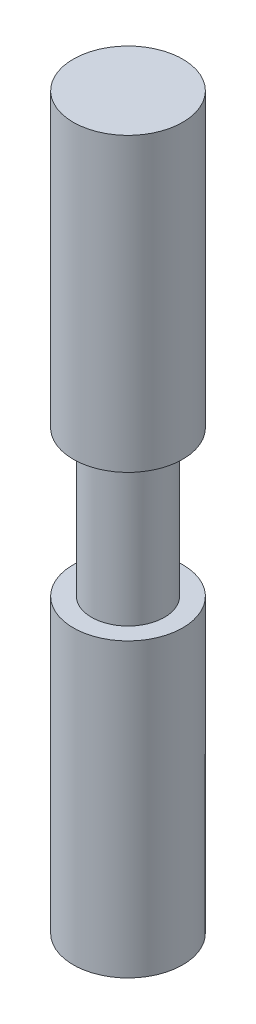
from build123d import *

# Parameters (mm, degrees)
SKETCH1_R           = 6.35
BOSS_EXTRUDE1_DEPTH = 25.4
SKETCH2_R           = 9.525
BOSS_EXTRUDE2_DEPTH = 50.8
BOSS_EXTRUDE3_START = 50.8
SKETCH3_R           = 9.525
BOSS_EXTRUDE3_DEPTH = 50.8


with BuildPart() as part:
    # Sketch1 → Boss-Extrude1 (new body)
    with BuildSketch(Plane(origin=(0, 0, 0), x_dir=(1, 0, 0), z_dir=(0, 1, 0))):
        Circle(SKETCH1_R)
    extrude(amount=BOSS_EXTRUDE1_DEPTH)

    # Sketch2 → Boss-Extrude2 (add)
    with BuildSketch(Plane(origin=(0, 25.4, 0), x_dir=(1, 0, 0), z_dir=(0, 1, 0))):
        Circle(SKETCH2_R)
    extrude(amount=BOSS_EXTRUDE2_DEPTH)

    # Sketch3 → Boss-Extrude3 (add)
    with BuildSketch(Plane.XZ.offset(BOSS_EXTRUDE3_START)):
        Circle(SKETCH3_R)
    extrude(amount=-BOSS_EXTRUDE3_DEPTH)


solid = part.part
